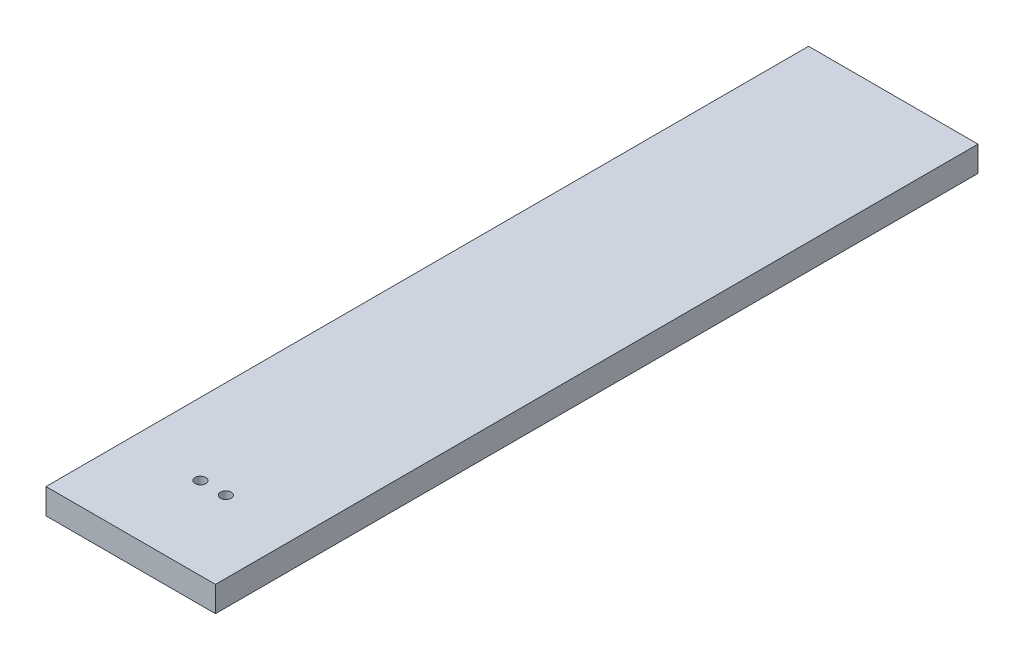
from build123d import *

# Parameters (mm, degrees)
SKETCH1_W          = 15.875
SKETCH1_H          = 71.4375
BASE_FLANGE1_DEPTH = 2.38125
SKETCH2_R          = 0.5
CUT_EXTRUDE1_DEPTH = 37.667470043


# Sheet-metal steps are written as plain solids
with BuildPart() as part:
    # Sketch1 → Base-Flange1 (new body)
    with BuildSketch(Plane(origin=(0, 0, 0), x_dir=(1, 0, 0), z_dir=(0, 1, 0))):
        Rectangle(SKETCH1_W, SKETCH1_H)
    extrude(amount=-BASE_FLANGE1_DEPTH)

    # Sketch2 → Cut-Extrude1 (cut, through all)
    with BuildSketch(Plane(origin=(0, 0, 0), x_dir=(1, 0, 0), z_dir=(0, 1, 0))):
        with Locations(Location((-1.19, -28, 0), (0, 0, 270))):
            Circle(SKETCH2_R)
        with Locations(Location((1.19, -28, 0), (0, 0, 270))):
            Circle(SKETCH2_R)
    extrude(amount=-CUT_EXTRUDE1_DEPTH, mode=Mode.SUBTRACT)


solid = part.part
